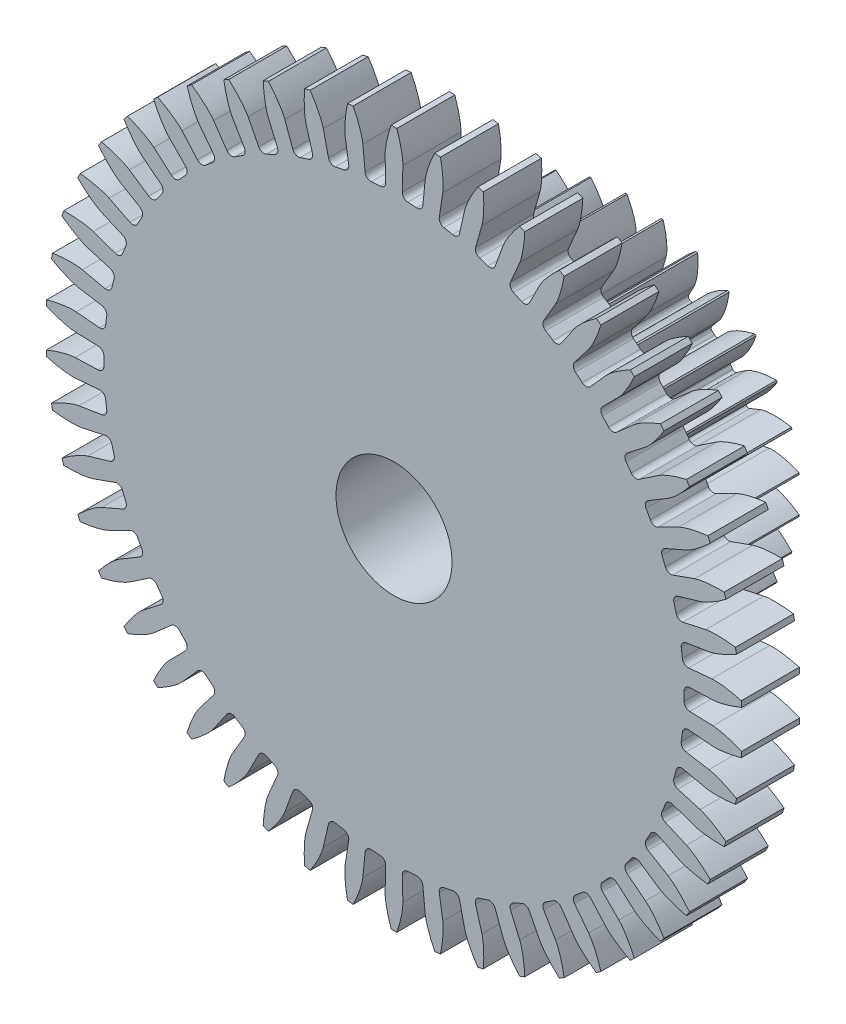
from build123d import *
from build123d.topology import SkipClean

# Parameters (mm, degrees)
SCHIZZO1_R                   = 6
SCHIZZO1_R_2                 = 1
ESTRUSIONE_ESTRUSIONE1_DEPTH = 1
TAGLIO_ESTRUSIONE1_REACH     = 10.544
RIPETIZIONECIRCOLARE1_COUNT  = 50
ESTRUSIONE_ESTRUSIONE2_START = 3
SCHIZZO3_R                   = 3
SCHIZZO3_R_2                 = 1
ESTRUSIONE_ESTRUSIONE2_DEPTH = 3
TAGLIO_ESTRUSIONE2_DEPTH     = 3
RIPETIZIONECIRCOLARE2_COUNT  = 30


with BuildPart() as part:
    # Schizzo1 → Estrusione-Estrusione1 (new body)
    with BuildSketch(Plane.XY):
        Circle(SCHIZZO1_R)
        Circle(SCHIZZO1_R_2, mode=Mode.SUBTRACT)
    extrude(amount=ESTRUSIONE_ESTRUSIONE1_DEPTH)

    # Schizzo2 → Taglio-Estrusione1 (cut, up to next)
    with BuildSketch(Plane.XY.offset(1), mode=Mode.PRIVATE) as taglio_estrusione1_sk1:
        with BuildLine():
            Line((8.314157972, -2.625050248), (8.314157972, 2.625050248))
            add(Edge.make_bspline(
                [(5.496649549, 0.191947232), (5.502322641, 0.192145341), (5.518215405, 0.193089941), (5.54816736, 0.196410592), (5.596786879, 0.203998752), (5.658272829, 0.216840512), (5.737043192, 0.237053235), (5.828780352, 0.265472856), (5.9282918, 0.301480685), (6.034948126, 0.345738691), (6.139778897, 0.39433292), (6.242747846, 0.446877442), (6.343783317, 0.502853712), (6.464208535, 0.574872467), (6.605787606, 0.667047298), (6.766787792, 0.783023197), (6.943804518, 0.924111954), (7.117744111, 1.077728151), (7.283416222, 1.236846949), (7.444047772, 1.406340067), (7.594636894, 1.576498943), (7.743595548, 1.761627921), (7.877331008, 1.936834331), (8.018443956, 2.14185432), (8.129813224, 2.30991191), (8.237297086, 2.490398222), (8.288480785, 2.579237003), (8.314157972, 2.625050248)],
                knots=[0, 0, 0, 0, 0, 0.005376748, 0.015083688, 0.02853182, 0.046610139, 0.064854849, 0.092110525, 0.119476175, 0.146842495, 0.174208853, 0.201574955, 0.228941013, 0.256307345, 0.307035032, 0.361767351, 0.41649966, 0.471231936, 0.525964281, 0.580696615, 0.635428982, 0.690161387, 0.744893688, 0.799626083, 0.854358409, 0.909090916, 0.909090916, 0.909090916, 0.909090916, 0.909090916], degree=4))
            Line((5.496649549, 0.191947232), (5.095913329, 0.177953215))
            ThreePointArc((5.095913329, 0.177953215), (5.026940081, 0.146927738), (4.999414979, 0.076484443))
            ThreePointArc((4.999414979, 0.076484443), (5, 0), (4.999414979, -0.076484443))
            ThreePointArc((4.999414979, -0.076484443), (5.026940081, -0.146927738), (5.095913329, -0.177953215))
            Line((5.095913329, -0.177953215), (5.496649549, -0.191947232))
            add(Edge.make_bspline(
                [(5.496649549, -0.191947232), (5.502322641, -0.192145341), (5.518215405, -0.193089941), (5.54816736, -0.196410592), (5.596786879, -0.203998752), (5.658272829, -0.216840512), (5.737043192, -0.237053235), (5.828780352, -0.265472856), (5.9282918, -0.301480685), (6.034948126, -0.345738691), (6.139778897, -0.39433292), (6.242747846, -0.446877442), (6.343783317, -0.502853712), (6.464208535, -0.574872467), (6.605787606, -0.667047298), (6.766787792, -0.783023197), (6.943804518, -0.924111954), (7.117744111, -1.077728151), (7.283416222, -1.236846949), (7.444047772, -1.406340067), (7.594636894, -1.576498943), (7.743595548, -1.761627921), (7.877331008, -1.936834331), (8.018443956, -2.14185432), (8.129813224, -2.30991191), (8.237297086, -2.490398222), (8.288480785, -2.579237003), (8.314157972, -2.625050248)],
                knots=[0, 0, 0, 0, 0, 0.005376748, 0.015083688, 0.02853182, 0.046610139, 0.064854849, 0.092110525, 0.119476175, 0.146842495, 0.174208853, 0.201574955, 0.228941013, 0.256307345, 0.307035032, 0.361767351, 0.41649966, 0.471231936, 0.525964281, 0.580696615, 0.635428982, 0.690161387, 0.744893688, 0.799626083, 0.854358409, 0.909090916, 0.909090916, 0.909090916, 0.909090916, 0.909090916], degree=4))
        make_face()
    taglio_estrusione1_tool1 = extrude(taglio_estrusione1_sk1.sketch, amount=-TAGLIO_ESTRUSIONE1_REACH, mode=Mode.PRIVATE) & part.part
    taglio_estrusione1 = taglio_estrusione1_tool1.solids().sort_by_distance((7.372142, 0, 1))[0]
    add(taglio_estrusione1, mode=Mode.SUBTRACT)

    # RipetizioneCircolare1: Taglio-Estrusione1 ×50 about axis
    ripetizionecircolare1_axis = Axis((0, 0, 1), (0, 0, 1))
    for i in range(1, RIPETIZIONECIRCOLARE1_COUNT):
        add(taglio_estrusione1.rotate(ripetizionecircolare1_axis, i * 360 / RIPETIZIONECIRCOLARE1_COUNT), mode=Mode.SUBTRACT)

    # Schizzo3 → Estrusione-Estrusione2 (add)
    with SkipClean():  # the faces are left unmerged after this step: merging them gives an invalid solid
        with BuildSketch(Plane(origin=(0, 0, 0), x_dir=(-1, 0, 0), z_dir=(0, 0, -1)).offset(ESTRUSIONE_ESTRUSIONE2_START)):
            with Locations(Location((0, 0, 0), (0, 0, 180))):
                Circle(SCHIZZO3_R)
            Circle(SCHIZZO3_R_2, mode=Mode.SUBTRACT)
        extrude(amount=-ESTRUSIONE_ESTRUSIONE2_DEPTH)

    # Schizzo4 → Taglio-Estrusione2 (cut)
    with SkipClean():  # the faces are left unmerged after this step: merging them gives an invalid solid
        with BuildSketch(Plane(origin=(0, 0, -3), x_dir=(-1, 0, 0), z_dir=(0, 0, -1))):
            with BuildLine():
                Line((3.705980677, -1.130007177), (3.705980677, 1.130007177))
                add(Edge.make_bspline(
                    [(2.498477068, 0.087248742), (2.500908393, 0.087333645), (2.507719577, 0.087738474), (2.520556129, 0.08916161), (2.541393066, 0.092413679), (2.579819517, 0.100439305), (2.625301297, 0.113321891), (2.675840335, 0.131027061), (2.729176458, 0.153159367), (2.774103931, 0.173985465), (2.818233481, 0.196504546), (2.861534397, 0.220494376), (2.913145205, 0.251359557), (2.973821949, 0.290863056), (3.042822029, 0.340567013), (3.11868634, 0.401033622), (3.19323188, 0.466869136), (3.264234213, 0.535062906), (3.333076306, 0.607702814), (3.397614501, 0.680628046), (3.461453924, 0.759969037), (3.518769122, 0.835057499), (3.579246099, 0.922923208), (3.626975786, 0.99494789), (3.673040298, 1.072299166), (3.694976169, 1.110372929), (3.705980677, 1.130007177)],
                    knots=[0, 0, 0, 0, 0, 0.005376748, 0.015083688, 0.02853182, 0.046610139, 0.092110525, 0.119476175, 0.146842495, 0.174208853, 0.201574955, 0.228941013, 0.256307345, 0.307035032, 0.361767351, 0.41649966, 0.471231936, 0.525964281, 0.580696615, 0.635428982, 0.690161387, 0.744893688, 0.799626083, 0.854358409, 0.909090916, 0.909090916, 0.909090916, 0.909090916, 0.909090916], degree=4))
                Line((2.498477068, 0.087248742), (2.298055691, 0.080249873))
                ThreePointArc((2.298055691, 0.080249873), (2.263605814, 0.064775733), (2.249804999, 0.029622064))
                ThreePointArc((2.249804999, 0.029622064), (2.25, 0), (2.249804999, -0.029622064))
                ThreePointArc((2.249804999, -0.029622064), (2.263605814, -0.064775733), (2.298055691, -0.080249873))
                Line((2.298055691, -0.080249873), (2.498477068, -0.087248742))
                add(Edge.make_bspline(
                    [(2.498477068, -0.087248742), (2.500908393, -0.087333645), (2.507719577, -0.087738474), (2.520556129, -0.08916161), (2.541393066, -0.092413679), (2.579819517, -0.100439305), (2.625301297, -0.113321891), (2.675840335, -0.131027061), (2.729176458, -0.153159367), (2.774103931, -0.173985465), (2.818233481, -0.196504546), (2.861534397, -0.220494376), (2.913145205, -0.251359557), (2.973821949, -0.290863056), (3.042822029, -0.340567013), (3.11868634, -0.401033622), (3.19323188, -0.466869136), (3.264234213, -0.535062906), (3.333076306, -0.607702814), (3.397614501, -0.680628046), (3.461453924, -0.759969037), (3.518769122, -0.835057499), (3.579246099, -0.922923208), (3.626975786, -0.994947889), (3.673040298, -1.072299166), (3.694976169, -1.110372929), (3.705980677, -1.130007177)],
                    knots=[0, 0, 0, 0, 0, 0.005376748, 0.015083688, 0.02853182, 0.046610139, 0.092110525, 0.119476175, 0.146842495, 0.174208853, 0.201574955, 0.228941013, 0.256307345, 0.307035032, 0.361767351, 0.41649966, 0.471231936, 0.525964281, 0.580696615, 0.635428982, 0.690161387, 0.744893688, 0.799626083, 0.854358409, 0.909090916, 0.909090916, 0.909090916, 0.909090916, 0.909090916], degree=4))
            make_face()
        taglio_estrusione2 = extrude(amount=-TAGLIO_ESTRUSIONE2_DEPTH, mode=Mode.SUBTRACT)

    # RipetizioneCircolare2: Taglio-Estrusione2 ×30 about axis
    with SkipClean():  # the faces are left unmerged after this step: merging them gives an invalid solid
        ripetizionecircolare2_axis = Axis((0, 0, 0), (0, 0, -1))
        for i in range(1, RIPETIZIONECIRCOLARE2_COUNT):
            add(taglio_estrusione2.rotate(ripetizionecircolare2_axis, i * 360 / RIPETIZIONECIRCOLARE2_COUNT), mode=Mode.SUBTRACT)


solid = part.part
